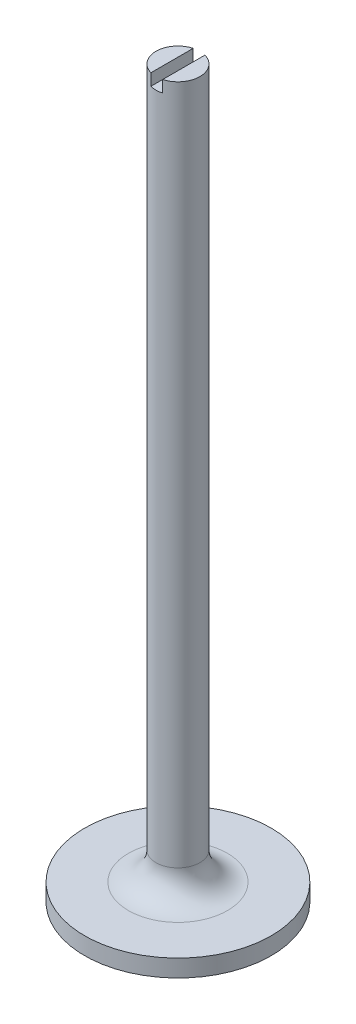
from build123d import *

# Parameters (mm, degrees)
FILLET1_R               = 4
CUT_EXTRUDE3_DEPTH      = 107.721600438
CUT_EXTRUDE3_DEPTH_BACK = 107.721600438
SKETCH4_W               = 1.7
SKETCH4_H               = 1.7


with BuildPart() as part:
    # Sketch1 → Revolve1 (revolve)
    with BuildSketch(Plane.XY):
        Polygon((0, 0), (13.5, 0), (13.5, 2.5), (3.175, 2.5), (3.175, 105), (0, 105), align=None)
    revolve(axis=Axis((0, -31.831703756, 0), (0, 1, 0)))

    # Fillet1
    fillet1_edges = [part.edges().sort_by_distance(p)[0] for p in [
        (-3.175, 2.5, 0),
    ]]
    fillet(fillet1_edges, radius=FILLET1_R)

    # Sketch4 → Cut-Extrude3 (cut, two sides: drawn at the far end of the back side and taken through both)
    with BuildSketch(Plane.XY.offset(-CUT_EXTRUDE3_DEPTH_BACK)):
        with Locations((0, 104.15)):
            Rectangle(SKETCH4_W, SKETCH4_H)
    extrude(amount=CUT_EXTRUDE3_DEPTH + CUT_EXTRUDE3_DEPTH_BACK, mode=Mode.SUBTRACT)


solid = part.part
